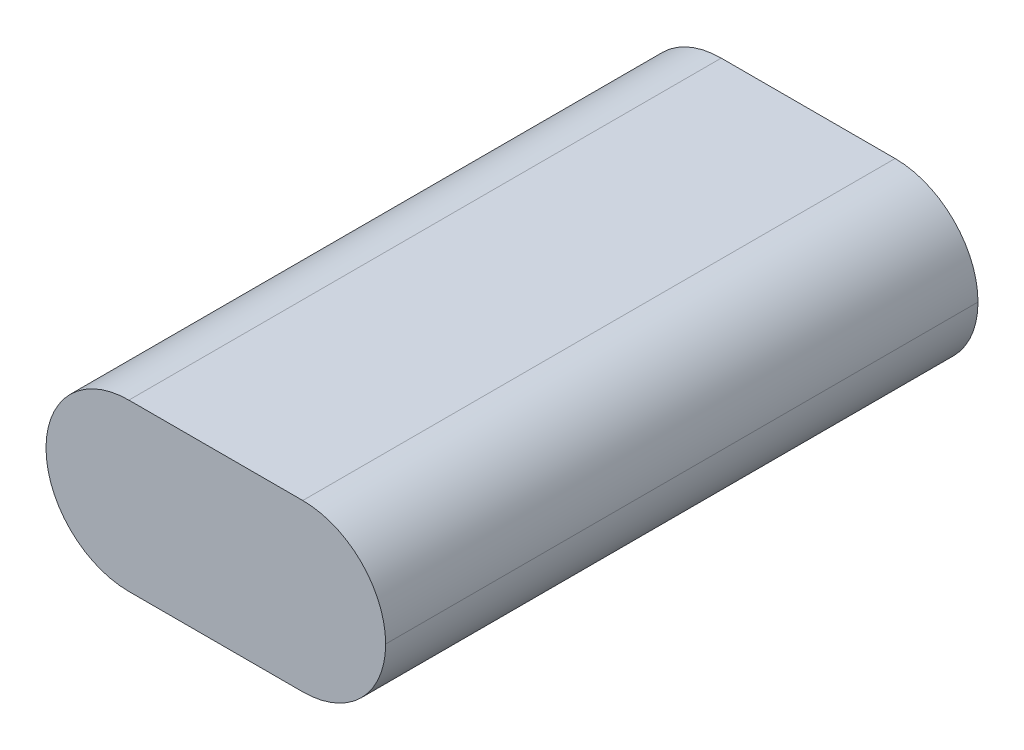
from build123d import *

# Parameters (mm, degrees)
SKETCH1_W           = 37.5
SKETCH1_H           = 65.4
BOSS_EXTRUDE1_DEPTH = 9.15
FILLET1_R           = 9.15


with BuildPart() as part:
    # Sketch1 → Boss-Extrude1 (new, symmetric)
    with BuildSketch(Plane(origin=(0, 0, 0), x_dir=(1, 0, 0), z_dir=(0, 1, 0))):
        Rectangle(SKETCH1_W, SKETCH1_H)
    extrude(amount=BOSS_EXTRUDE1_DEPTH, both=True)

    # Fillet1
    fillet1_edges = [part.edges().sort_by_distance(p)[0] for p in [
        (18.75, -9.15, 0),
        (18.75, 9.15, 0),
        (-18.75, -9.15, 0),
        (-18.75, 9.15, 0),
    ]]
    fillet(fillet1_edges, radius=FILLET1_R - 0.0001)  # a hair under: the kernel refuses the full size


solid = part.part
